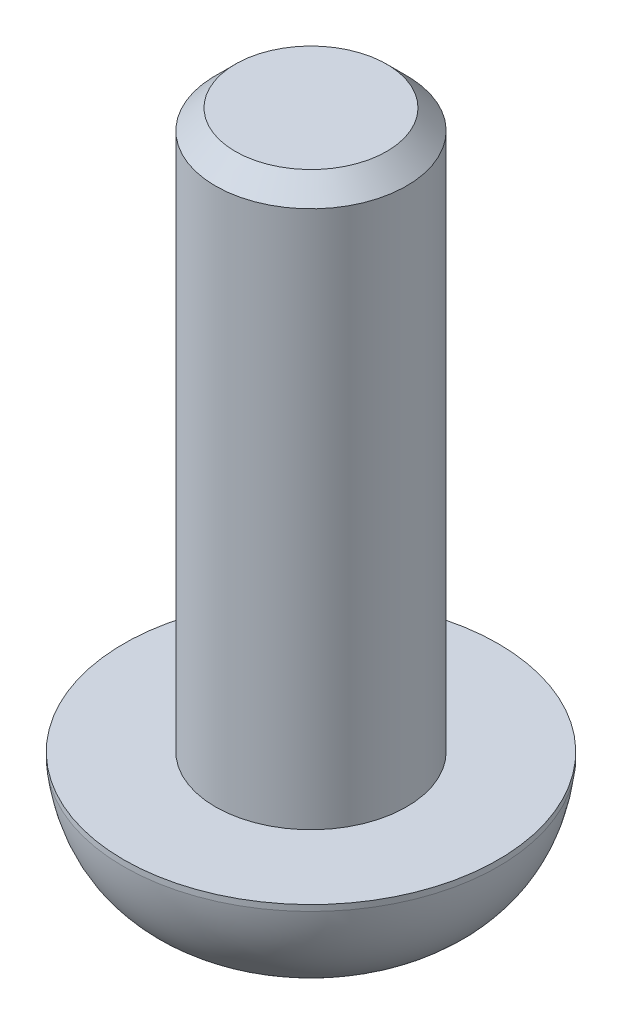
from build123d import *

# Parameters (mm, degrees)
SKETCH1_R           = 4.7
BOSS_EXTRUDE1_DEPTH = 3
SKETCH2_R           = 2.4
BOSS_EXTRUDE2_DEPTH = 14
CUT_EXTRUDE1_DEPTH  = 1.5
CHAMFER1_SIZE       = 0.5


with BuildPart() as part:
    # Sketch1 → Boss-Extrude1 (new body)
    with BuildSketch(Plane(origin=(0, 0, 0), x_dir=(1, 0, 0), z_dir=(0, 1, 0))):
        Circle(SKETCH1_R)
    extrude(amount=BOSS_EXTRUDE1_DEPTH)

    # Sketch2 → Boss-Extrude2 (add)
    with BuildSketch(Plane(origin=(0, 3, 0), x_dir=(1, 0, 0), z_dir=(0, 1, 0))):
        Circle(SKETCH2_R)
    extrude(amount=BOSS_EXTRUDE2_DEPTH)

    # Sketch3 → Cut-Revolve1 (revolve, cut)
    with BuildSketch(Plane.XY):
        with BuildLine():
            Line((2.35, 0), (4.7, 0))
            Line((4.7, 0), (4.7, 2.85))
            add(Edge.make_bspline(
                [(2.35, 0), (4.432462228, 0.599611143), (4.7, 2.85)],
                knots=[0, 0, 0, 1, 1, 1], degree=2))
        make_face()
    revolve(axis=Axis((0, 0, 0), (0, 1, 0)), mode=Mode.SUBTRACT)

    # Sketch4 → Cut-Extrude1 (cut)
    with BuildSketch(Plane.XZ):
        Polygon((0, 1.732050808), (-1.5, 0.866025404), (-1.5, -0.866025404), (0, -1.732050808), (1.5, -0.866025404), (1.5, 0.866025404), align=None)
    extrude(amount=-CUT_EXTRUDE1_DEPTH, mode=Mode.SUBTRACT)

    # Chamfer1
    chamfer1_edges = [part.edges().sort_by_distance(p)[0] for p in [
        (-2.4, 17, 0),
    ]]
    chamfer(chamfer1_edges, length=CHAMFER1_SIZE)


solid = part.part
